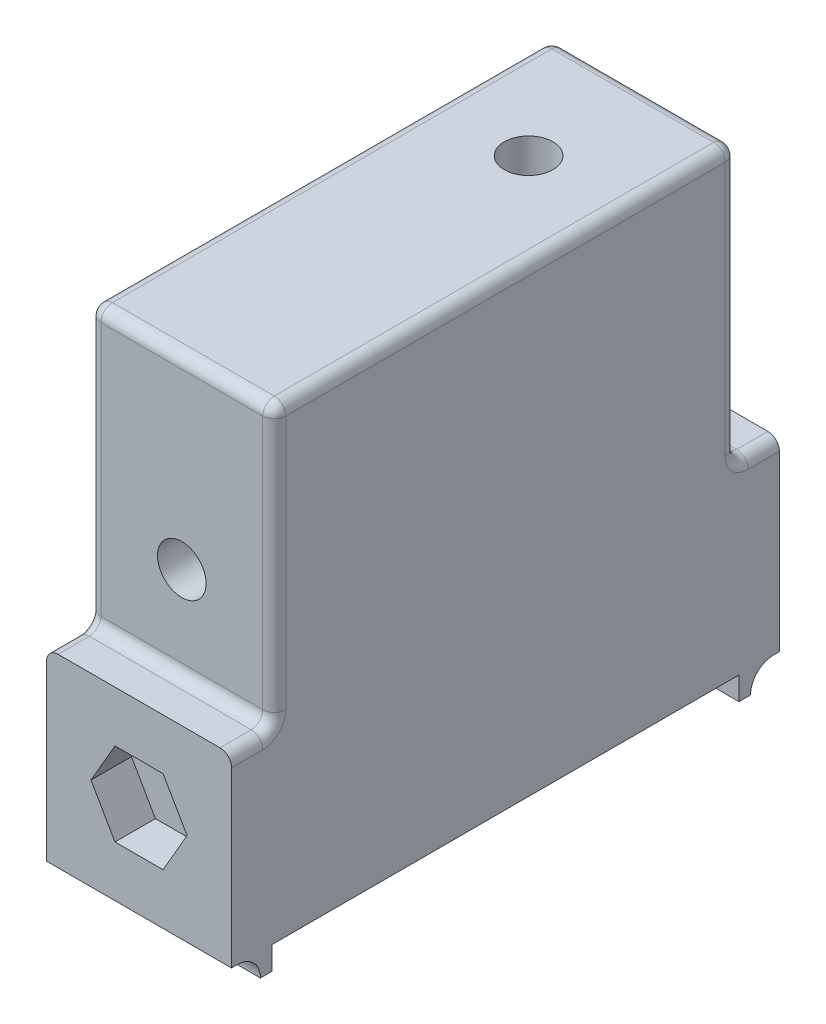
from build123d import *

# Parameters (mm, degrees)
SKETCH1_W           = 16
SKETCH1_H           = 40
BOSS_EXTRUDE1_DEPTH = 40
SKETCH2_W           = 16
SKETCH2_H           = 3.7
BOSS_EXTRUDE2_DEPTH = 16
SKETCH5_W           = 10
SKETCH5_H           = 34
CUT_EXTRUDE3_DEPTH  = 37
FILLET1_R           = 1
FILLET2_R           = 1
CUT_EXTRUDE6_DEPTH  = 3.5
SKETCH9_W           = 16
SKETCH9_H           = 1
BOSS_EXTRUDE3_DEPTH = 2
CUT_EXTRUDE7_REACH  = 61.78
SKETCH12_R          = 2.1
CUT_EXTRUDE8_REACH  = 50.884
SKETCH13_R          = 2.1
FILLET3_R           = 2


with BuildPart() as part:
    # Sketch1 → Boss-Extrude1 (new body)
    with BuildSketch(Plane(origin=(0, 0, 0), x_dir=(1, 0, 0), z_dir=(0, 1, 0))):
        Rectangle(SKETCH1_W, SKETCH1_H)
    extrude(amount=BOSS_EXTRUDE1_DEPTH)

    # Sketch2 → Boss-Extrude2 (add)
    with BuildSketch(Plane.XZ):
        with Locations((0, 21.85)):
            Rectangle(SKETCH2_W, SKETCH2_H)
        with Locations((0, -21.85)):
            Rectangle(SKETCH2_W, SKETCH2_H)
    extrude(amount=-BOSS_EXTRUDE2_DEPTH)

    # Sketch5 → Cut-Extrude3 (cut)
    with BuildSketch(Plane.XZ):
        Rectangle(SKETCH5_W, SKETCH5_H)
    extrude(amount=-CUT_EXTRUDE3_DEPTH, mode=Mode.SUBTRACT)

    # Fillet1
    fillet1_edges = [part.edges().sort_by_distance(p)[0] for p in [
        (8, 40, 0),
        (0, 40, -20),
        (-8, 16, 21.85),
        (8, 16, 21.85),
        (0, 16, 20),
        (-8, 16, -21.85),
        (0, 16, -20),
        (8, 16, -21.85),
        (-8, 40, 0),
        (0, 40, 20),
        (-8, 28, -20),
        (8, 28, -20),
        (8, 28, 20),
        (-8, 28, 20),
    ]]
    fillet(fillet1_edges, radius=FILLET1_R)

    # Fillet2
    fillet2_edges = [part.edges().sort_by_distance(p)[0] for p in [
        (-5, 37, 0),
        (-5, 18.5, -17),
        (0, 37, 17),
        (-5, 18.5, 17),
        (5, 37, 0),
        (5, 18.5, 17),
        (0, 37, -17),
        (5, 18.5, -17),
    ]]
    fillet(fillet2_edges, radius=FILLET2_R)

    # Sketch3 → Cut-Extrude6 (cut)
    with BuildSketch(Plane(origin=(0, 0, -23.7), x_dir=(-1, 0, 0), z_dir=(0, 0, -1))):
        Polygon((2.078460969, 11.6), (-2.078460969, 11.6), (-4.156921938, 8), (-2.078460969, 4.4), (2.078460969, 4.4), (4.156921938, 8), align=None)
    cut_extrude6 = extrude(amount=-CUT_EXTRUDE6_DEPTH, mode=Mode.SUBTRACT)

    # Mirror2: Cut-Extrude6 across plane
    add(cut_extrude6.mirror(Plane.XY), mode=Mode.SUBTRACT)

    # Sketch9 → Boss-Extrude3 (add)
    with BuildSketch(Plane.XZ):
        with Locations((0, 20.7)):
            Rectangle(SKETCH9_W, SKETCH9_H)
        with Locations((0, -20.7)):
            Rectangle(SKETCH9_W, SKETCH9_H)
    extrude(amount=BOSS_EXTRUDE3_DEPTH)

    # Sketch12 → Cut-Extrude7 (cut, up to next)
    with BuildSketch(Plane.XY.offset(20), mode=Mode.PRIVATE) as cut_extrude7_sk1:
        with Locations((0, 24)):
            Circle(SKETCH12_R)
    cut_extrude7_tool1 = extrude(cut_extrude7_sk1.sketch, amount=-CUT_EXTRUDE7_REACH, mode=Mode.PRIVATE) & part.part
    add(cut_extrude7_tool1.solids().sort_by_distance((0, 24, 20))[0], mode=Mode.SUBTRACT)

    # Sketch13 → Cut-Extrude8 (cut, up to next)
    with BuildSketch(Plane(origin=(0, 40, 0), x_dir=(1, 0, 0), z_dir=(0, 1, 0)), mode=Mode.PRIVATE) as cut_extrude8_sk1:
        with Locations(Location((0, 10, 0), (0, 0, 270))):
            Circle(SKETCH13_R)
    cut_extrude8_tool1 = extrude(cut_extrude8_sk1.sketch, amount=-CUT_EXTRUDE8_REACH, mode=Mode.PRIVATE) & part.part
    add(cut_extrude8_tool1.solids().sort_by_distance((0, 40, -10))[0], mode=Mode.SUBTRACT)

    # Fillet3
    fillet3_edges = [part.edges().sort_by_distance(p)[0] for p in [
        (0, 0, 21.2),
        (0, 0, -21.2),
    ]]
    fillet(fillet3_edges, radius=FILLET3_R - 0.0001)  # a hair under: the kernel refuses the full size


solid = part.part
